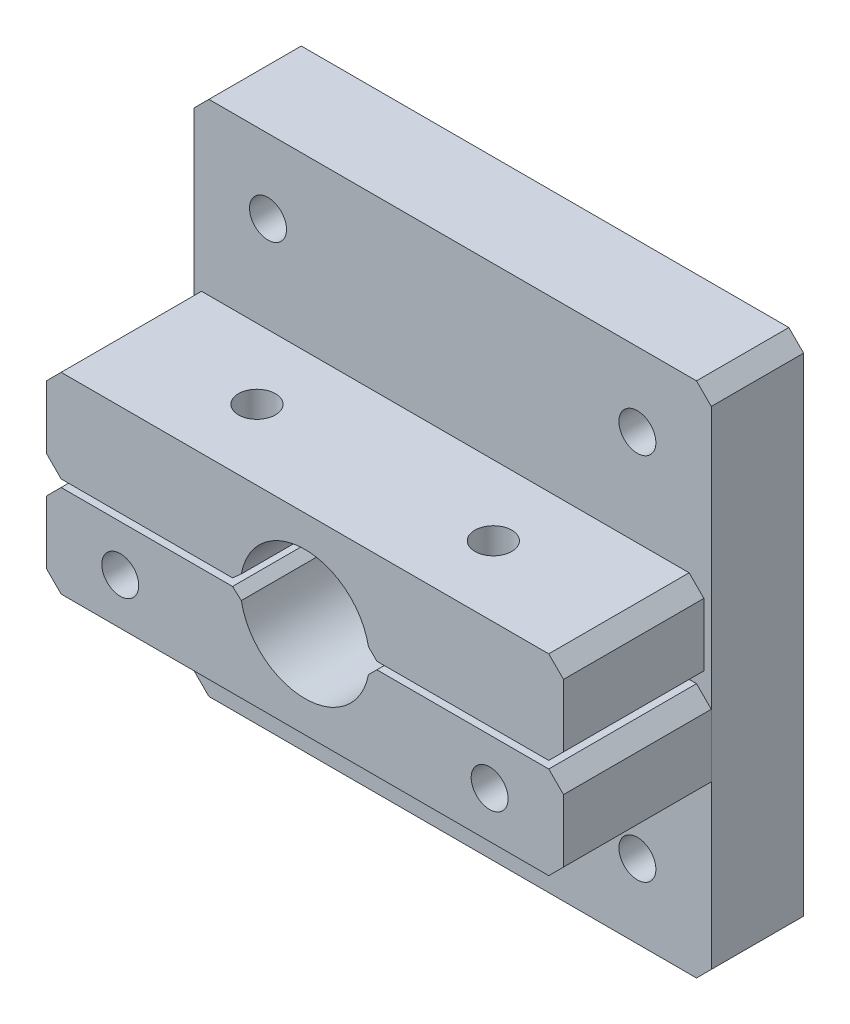
from build123d import *

# Parameters (mm, degrees)
SKETCH1_W               = 88.9
SKETCH1_H               = 27.94
SKETCH1_R               = 3.175
BOSS_EXTRUDE1_DEPTH     = 7.9375
BOSS_EXTRUDE2_START     = 7.9375
SKETCH1_3_R             = 3.175
BOSS_EXTRUDE2_DEPTH     = 25.4
BOSS_EXTRUDE3_START     = 33.3375
BOSS_EXTRUDE3_DEPTH     = 24.13
CUT_EXTRUDE1_DEPTH      = 72.154718088
CUT_EXTRUDE1_DEPTH_BACK = 72.154718088
SKETCH2_R               = 3.175
BOSS_EXTRUDE4_START     = -7.9375
SKETCH1_5_W             = 88.9
SKETCH1_5_H             = 88.9
SKETCH1_5_R             = 3.175
SKETCH1_5_R_2           = 4.7625
BOSS_EXTRUDE4_DEPTH     = 7.9375
CHAMFER1_SIZE           = 2.54
CHAMFER2_SIZE           = 2.54
CHAMFER3_SIZE           = 2.54
CHAMFER4_SIZE           = 1.349308072
CHAMFER4_SIZE_2         = 1.27
CHAMFER5_SIZE           = 1.349308072
CHAMFER5_SIZE_2         = 1.27


with BuildPart() as part:
    # Sketch1 → Boss-Extrude1 (new body)
    # profile 1 of 6: a face of its own
    with BuildSketch(Plane.XY):
        with Locations((0, 30.48)):
            Rectangle(SKETCH1_W, SKETCH1_H)
        with Locations((-31.75, 31.75)):
            Circle(SKETCH1_R, mode=Mode.SUBTRACT)
        with Locations((31.75, 31.75)):
            Circle(SKETCH1_R, mode=Mode.SUBTRACT)
    # profile 2 of 6: a face of its own
    with BuildSketch(Plane.XY):
        with BuildLine():
            Line((44.45, 16.51), (-44.45, 16.51))
            Line((-44.45, 16.51), (-44.45, 0.635))
            Line((-44.45, 0.635), (-11.094342308, 0.635))
            ThreePointArc((-11.094342308, 0.635), (0, 11.1125), (11.094342308, 0.635))
            Line((11.094342308, 0.635), (44.45, 0.635))
            Line((44.45, 0.635), (44.45, 16.51))
        make_face()
    # profile 3 of 6: a face of its own
    with BuildSketch(Plane.XY):
        with BuildLine():
            Line((44.45, -16.51), (44.45, -0.635))
            Line((44.45, -0.635), (11.094342308, -0.635))
            ThreePointArc((11.094342308, -0.635), (0, -11.1125), (-11.094342308, -0.635))
            Line((-11.094342308, -0.635), (-44.45, -0.635))
            Line((-44.45, -0.635), (-44.45, -16.51))
            Line((-44.45, -16.51), (44.45, -16.51))
        make_face()
        with Locations((-31.75, -8.5725)):
            Circle(SKETCH1_R, mode=Mode.SUBTRACT)
        with Locations((31.75, -8.5725)):
            Circle(SKETCH1_R, mode=Mode.SUBTRACT)
    # profile 4 of 6: a face of its own
    with BuildSketch(Plane.XY):
        with Locations((0, -30.48)):
            Rectangle(SKETCH1_W, SKETCH1_H)
        with Locations((-31.75, -31.75)):
            Circle(SKETCH1_R, mode=Mode.SUBTRACT)
        with Locations((31.75, -31.75)):
            Circle(SKETCH1_R, mode=Mode.SUBTRACT)
    # profile 5 of 6: a face of its own
    with BuildSketch(Plane.XY):
        with BuildLine():
            Line((-11.094342308, 0.635), (-44.45, 0.635))
            Line((-44.45, 0.635), (-44.45, 0))
            Line((-44.45, 0), (-44.45, -0.635))
            Line((-44.45, -0.635), (-11.094342308, -0.635))
            ThreePointArc((-11.094342308, -0.635), (-11.1125, 0), (-11.094342308, 0.635))
        make_face()
    # profile 6 of 6: a face of its own
    with BuildSketch(Plane.XY):
        with BuildLine():
            Line((44.45, -0.635), (44.45, 0.635))
            Line((44.45, 0.635), (11.094342308, 0.635))
            ThreePointArc((11.094342308, 0.635), (11.107959649, 0.317629777), (11.1125, 0))
            ThreePointArc((11.1125, 0), (11.107959649, -0.317629777), (11.094342308, -0.635))
            Line((11.094342308, -0.635), (44.45, -0.635))
        make_face()
    extrude(amount=BOSS_EXTRUDE1_DEPTH)

    # Sketch1<5> → Boss-Extrude4 (add)
    with BuildSketch(Plane.XY.offset(BOSS_EXTRUDE4_START)):
        Rectangle(SKETCH1_5_W, SKETCH1_5_H)
        with Locations((-31.75, 31.75)):
            Circle(SKETCH1_5_R, mode=Mode.SUBTRACT)
        with Locations((31.75, 31.75)):
            Circle(SKETCH1_5_R, mode=Mode.SUBTRACT)
        Circle(SKETCH1_5_R_2, mode=Mode.SUBTRACT)
        with Locations((31.75, -8.5725)):
            Circle(SKETCH1_5_R, mode=Mode.SUBTRACT)
        with Locations((-31.75, -8.5725)):
            Circle(SKETCH1_5_R, mode=Mode.SUBTRACT)
        with Locations((31.75, -31.75)):
            Circle(SKETCH1_5_R, mode=Mode.SUBTRACT)
        with Locations((-31.75, -31.75)):
            Circle(SKETCH1_5_R, mode=Mode.SUBTRACT)
    extrude(amount=BOSS_EXTRUDE4_DEPTH)

    # Chamfer1
    chamfer1_edges = [part.edges().sort_by_distance(p)[0] for p in [
        (-44.45, -44.45, 0),
        (-44.45, 44.45, 0),
        (44.45, 44.45, 0),
        (44.45, -44.45, 0),
    ]]
    chamfer(chamfer1_edges, length=CHAMFER1_SIZE)


with BuildPart() as body_2:
    # Sketch1<3> → Boss-Extrude2 (new body)
    with BuildSketch(Plane.XY.offset(BOSS_EXTRUDE2_START)):
        with BuildLine():
            Line((44.45, -16.51), (44.45, -0.635))
            Line((44.45, -0.635), (11.094342308, -0.635))
            ThreePointArc((11.094342308, -0.635), (0, -11.1125), (-11.094342308, -0.635))
            Line((-11.094342308, -0.635), (-44.45, -0.635))
            Line((-44.45, -0.635), (-44.45, -16.51))
            Line((-44.45, -16.51), (44.45, -16.51))
        make_face()
        with Locations((-31.75, -8.5725)):
            Circle(SKETCH1_3_R, mode=Mode.SUBTRACT)
        with Locations((31.75, -8.5725)):
            Circle(SKETCH1_3_R, mode=Mode.SUBTRACT)
    extrude(amount=BOSS_EXTRUDE2_DEPTH)


with BuildPart() as body_3:
    # Sketch1<4> → Boss-Extrude3 (new body)
    with BuildSketch(Plane.XY.offset(BOSS_EXTRUDE3_START)):
        with BuildLine():
            Line((44.45, 16.51), (-44.45, 16.51))
            Line((-44.45, 16.51), (-44.45, 0.635))
            Line((-44.45, 0.635), (-11.094342308, 0.635))
            ThreePointArc((-11.094342308, 0.635), (0, 11.1125), (11.094342308, 0.635))
            Line((11.094342308, 0.635), (44.45, 0.635))
            Line((44.45, 0.635), (44.45, 16.51))
        make_face()
    extrude(amount=-BOSS_EXTRUDE3_DEPTH)


with BuildPart() as cut_extrude1_tool:
    # Sketch2 → Cut-Extrude1 (new, two sides: drawn at the far end of the back side and taken through both)
    with BuildSketch(Plane(origin=(0, 0, 0), x_dir=(1, 0, 0), z_dir=(0, 1, 0)).offset(-CUT_EXTRUDE1_DEPTH_BACK)):
        with Locations(Location((20.32, -21.2725, 0), (0, 0, 270))):
            Circle(SKETCH2_R)
        with Locations(Location((-20.32, -21.2725, 0), (0, 0, 270))):
            Circle(SKETCH2_R)
    extrude(amount=CUT_EXTRUDE1_DEPTH + CUT_EXTRUDE1_DEPTH_BACK)


with BuildPart() as body_2_1:
    add(body_2.part)

    # Cut-Extrude1: cut by cut_extrude1_tool
    add(cut_extrude1_tool.part, mode=Mode.SUBTRACT)

    # Chamfer2
    chamfer2_edges = [body_2_1.edges().sort_by_distance(p)[0] for p in [
        (44.45, -16.51, 20.6375),
        (-44.45, -16.51, 20.6375),
        (-44.45, -0.635, 20.6375),
        (44.45, -0.635, 20.6375),
    ]]
    chamfer(chamfer2_edges, length=CHAMFER2_SIZE)

    # Chamfer4
    # the kernel refuses this chamfer: 1.349308072, 1.27 mm, written as the material it takes off along each edge
    with BuildSketch(Plane(origin=(-11.094342308, -0.635, 4.44742728), x_dir=(0.11791105976871491, -0.9930241598189938, 0), z_dir=(0, 0, 1))) as chamfer4_piece_1:
        with BuildLine():
            Line((1.355150635, 0), (-CHAMFER4_SIZE * 0.117911059734, -CHAMFER4_SIZE * 0.993024159525))
            Line((-CHAMFER4_SIZE * 0.117911059734, -CHAMFER4_SIZE * 0.993024159525), (0, 0))
            ThreePointArc((0, 0), (0.697855763, -0.020658022), (1.355150635, 0))
        make_face()
    extrude(amount=32.38014544, mode=Mode.SUBTRACT)
    with BuildSketch(Plane(origin=(11.094342308, -0.635, 4.180143516), x_dir=(1, 0, 0), z_dir=(0, 0, 1))) as chamfer4_piece_2:
        with BuildLine():
            Line((CHAMFER4_SIZE_2, 0), (-0.179005517, -1.449005517))
            ThreePointArc((-0.179005517, -1.449005517), (-0.068318427, -0.748637825), (0, 0))
            Line((0, 0), (CHAMFER4_SIZE_2, 0))
        make_face()
    extrude(amount=32.914712968, mode=Mode.SUBTRACT)


with BuildPart() as body_3_1:
    add(body_3.part)

    # Cut-Extrude1: cut by cut_extrude1_tool
    add(cut_extrude1_tool.part, mode=Mode.SUBTRACT)

    # Chamfer3
    chamfer3_edges = [body_3_1.edges().sort_by_distance(p)[0] for p in [
        (-44.45, 0.635, 21.2725),
        (44.45, 0.635, 21.2725),
        (44.45, 16.51, 21.2725),
        (-44.45, 16.51, 21.2725),
    ]]
    chamfer(chamfer3_edges, length=CHAMFER3_SIZE)

    # Chamfer5
    # the kernel refuses this chamfer: 1.349308072, 1.27 mm, written as the material it takes off along each edge
    with BuildSketch(Plane(origin=(-11.094342308, 0.635, 36.82757272), x_dir=(0.11791105976871363, 0.993024159818994, 0), z_dir=(0, 0, -1))) as chamfer5_piece_1:
        with BuildLine():
            Line((1.355150635, 0), (-CHAMFER5_SIZE * 0.117911059734, -CHAMFER5_SIZE * 0.993024159525))
            Line((-CHAMFER5_SIZE * 0.117911059734, -CHAMFER5_SIZE * 0.993024159525), (0, 0))
            ThreePointArc((0, 0), (0.697855763, -0.020658022), (1.355150635, 0))
        make_face()
    extrude(amount=31.11014544, mode=Mode.SUBTRACT)
    with BuildSketch(Plane(origin=(11.094342308, 0.635, 37.094856484), x_dir=(1, 0, 0), z_dir=(0, 0, -1))) as chamfer5_piece_2:
        with BuildLine():
            Line((CHAMFER5_SIZE_2, 0), (-0.179005517, -1.449005517))
            ThreePointArc((-0.179005517, -1.449005517), (-0.068318427, -0.748637825), (0, 0))
            Line((0, 0), (CHAMFER5_SIZE_2, 0))
        make_face()
    extrude(amount=31.644712968, mode=Mode.SUBTRACT)


solid = Compound([part.part, body_2_1.part, body_3_1.part])
